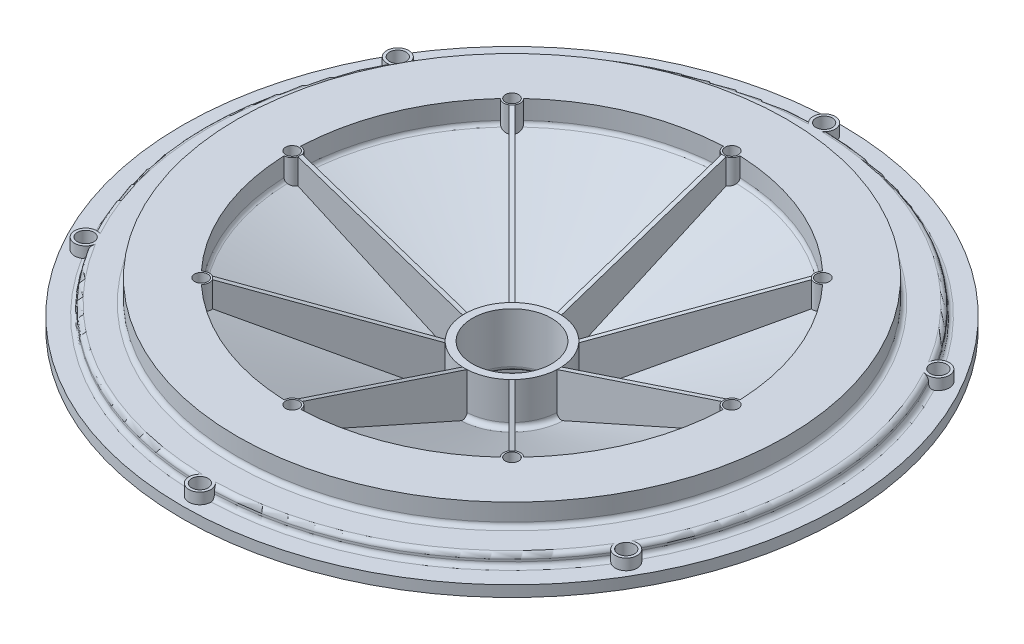
from build123d import *

# Parameters (mm, degrees)
BOSS_EXTRUDE1_REACH = 24.497
SKETCH5_R           = 0.375
BOSS_EXTRUDE2_REACH = 24.187
SKETCH8_R           = 0.5
SKETCH29_R          = 0.3
CUT_EXTRUDE2_DEPTH  = 1
CIRPATTERN4_COUNT   = 8
CIRPATTERN5_COUNT   = 8
SKETCH35_R          = 0.375
CUT_EXTRUDE3_DEPTH  = 1
CIRPATTERN8_COUNT   = 6
CIRPATTERN10_COUNT  = 6
BOSS_EXTRUDE3_REACH = 24.497
CIRPATTERN25_COUNT  = 8
SCALE1_SCALE        = 5


with BuildPart() as part:
    # Sketch4 → Revolve3 (revolve)
    with BuildSketch(Plane.XY, mode=Mode.PRIVATE) as revolve3_sk:
        with BuildLine():
            Line((1.8, 2.5), (1.8, 0.22))
            ThreePointArc((1.8, 0.22), (1.858578644, 0.078578644), (2, 0.02))
            Line((2, 0.02), (4.35, 0.02))
            ThreePointArc((4.35, 0.02), (4.491421356, -0.038578644), (4.55, -0.18))
            Line((4.55, -0.18), (4.55, -1.95))
            ThreePointArc((4.55, -1.95), (4.491421356, -2.091421356), (4.35, -2.15))
            Line((4.35, -2.15), (2.15, -2.15))
            Line((2.15, -2.15), (2.15, -2.3))
            ThreePointArc((2.15, -2.3), (2.208578644, -2.441421356), (2.35, -2.5))
            Line((2.35, -2.5), (4.9, -2.5))
            Line((4.9, -2.5), (4.9, -1.258504677))
            Line((4.9, -1.258504677), (4.9, 1.048861414))
            ThreePointArc((4.9, 1.048861414), (4.932237209, 1.157745049), (5.01855646, 1.231527639))
            Line((5.01855646, 1.231527639), (10.4, 3.63089737))
            Line((10.4, 3.63089737), (13.3, 3.63089737))
            ThreePointArc((13.3, 3.63089737), (13.441421356, 3.572318727), (13.5, 3.43089737))
            Line((13.5, 3.43089737), (13.5, 3))
            Line((13.5, 3), (15, 3))
            Line((15, 3), (15, 3.5))
            Line((15, 3.5), (14.2, 3.5))
            ThreePointArc((14.2, 3.5), (14.058578644, 3.558578644), (14, 3.7))
            Line((14, 3.7), (14, 3.8))
            ThreePointArc((14, 3.8), (13.941421356, 3.941421356), (13.8, 4))
            Line((13.8, 4), (12.7, 4))
            ThreePointArc((12.7, 4), (12.558578644, 4.058578644), (12.5, 4.2))
            Line((12.5, 4.2), (12.5, 4.989962757))
            Line((12.5, 4.989962757), (10, 4.989962757))
            Line((10, 4.989962757), (10, 4.129806657))
            ThreePointArc((10, 4.129806657), (9.967762791, 4.020923022), (9.88144354, 3.947140432))
            Line((9.88144354, 3.947140432), (2.43144354, 0.625484381))
            ThreePointArc((2.43144354, 0.625484381), (2.241116365, 0.640387815), (2.15, 0.808150606))
            Line((2.15, 0.808150606), (2.15, 2.5))
            Line((2.15, 2.5), (1.8, 2.5))
        make_face()
    revolve(revolve3_sk.sketch.rotate(Axis((0, 0, 0), (0, 1, 0)), 90), axis=Axis((0, 0, 0), (0, 1, 0)))

    # Boss-Extrude1: up to this cone (the profile starts inside it)
    boss_extrude1_end = Plane(origin=(0, 4.989963, 0), z_dir=(0, 1, 0)).offset(-5.448560726) * Cone(2.243e-06, 95.693534971, 42.665906312, align=(Align.CENTER, Align.CENTER, Align.MIN), mode=Mode.PRIVATE)
    # Sketch5 → Boss-Extrude1 (add, up to the surface)
    with BuildSketch(Plane(origin=(0, 4.989962757, 0), x_dir=(1, 0, 0), z_dir=(0, 1, 0)), mode=Mode.PRIVATE) as boss_extrude1_sk1:
        with Locations((0, 10)):
            Circle(SKETCH5_R)
    boss_extrude1_tool1 = extrude(boss_extrude1_sk1.sketch, amount=-BOSS_EXTRUDE1_REACH, mode=Mode.PRIVATE) & boss_extrude1_end
    boss_extrude1 = boss_extrude1_tool1.solids().sort_by_distance((0, 4.989963, -10))[0]
    add(boss_extrude1)

    # Boss-Extrude2: up to this face of the body (flat: up to its plane)
    boss_extrude2_end = Plane(part.part.faces().sort_by_distance((0, 3.5, 14.575735931))[0])
    # Sketch8 → Boss-Extrude2 (add, up to the picked face)
    with BuildSketch(Plane(origin=(0, 4, 0), x_dir=(1, 0, 0), z_dir=(0, 1, 0)), mode=Mode.PRIVATE) as boss_extrude2_sk1:
        with Locations((0, 14.2)):
            Circle(SKETCH8_R)
    boss_extrude2_tool1 = split(extrude(boss_extrude2_sk1.sketch, amount=-BOSS_EXTRUDE2_REACH, mode=Mode.PRIVATE), bisect_by=boss_extrude2_end, keep=Keep.BOTH, mode=Mode.PRIVATE)
    boss_extrude2 = boss_extrude2_tool1.solids().sort_by(Axis((0, 4, -14.2), (0, -1, 0)))[0]
    add(boss_extrude2)

    # Sketch29 → Cut-Extrude2 (cut)
    with BuildSketch(Plane(origin=(0, 4.989962757, 0), x_dir=(1, 0, 0), z_dir=(0, 1, 0))):
        with Locations(Location((0, 10, 0), (0, 0, 270))):
            Circle(SKETCH29_R)
    cut_extrude2 = extrude(amount=-CUT_EXTRUDE2_DEPTH, mode=Mode.SUBTRACT)

    # CirPattern4: Boss-Extrude1 ×8 about axis
    cirpattern4_axis = Axis((0, 0, 0), (0, 1, 0))
    for i in range(1, CIRPATTERN4_COUNT):
        add(boss_extrude1.rotate(cirpattern4_axis, i * 360 / CIRPATTERN4_COUNT))

    # CirPattern5: Cut-Extrude2 ×8 about axis
    cirpattern5_axis = Axis((0, 0, 0), (0, 1, 0))
    for i in range(1, CIRPATTERN5_COUNT):
        add(cut_extrude2.rotate(cirpattern5_axis, i * 360 / CIRPATTERN5_COUNT), mode=Mode.SUBTRACT)

    # Sketch35 → Cut-Extrude3 (cut)
    with BuildSketch(Plane(origin=(0, 4, 0), x_dir=(1, 0, 0), z_dir=(0, 1, 0))):
        with Locations(Location((0, 14.2, 0), (0, 0, 270))):
            Circle(SKETCH35_R)
    cut_extrude3 = extrude(amount=-CUT_EXTRUDE3_DEPTH, mode=Mode.SUBTRACT)

    # CirPattern8: Boss-Extrude2 ×6 about axis
    cirpattern8_axis = Axis((0, 0, 0), (0, 1, 0))
    for i in range(1, CIRPATTERN8_COUNT):
        add(boss_extrude2.rotate(cirpattern8_axis, i * 360 / CIRPATTERN8_COUNT))

    # CirPattern10: Cut-Extrude3 ×6 about axis
    cirpattern10_axis = Axis((0, 0, 0), (0, 1, 0))
    for i in range(1, CIRPATTERN10_COUNT):
        add(cut_extrude3.rotate(cirpattern10_axis, i * 360 / CIRPATTERN10_COUNT), mode=Mode.SUBTRACT)

    # Boss-Extrude3: up to this cone (the profile starts inside it)
    boss_extrude3_end = Plane(origin=(0, 4.989963, 0), z_dir=(0, 1, 0)).offset(-5.448560726) * Cone(2.243e-06, 95.693534971, 42.665906312, align=(Align.CENTER, Align.CENTER, Align.MIN), mode=Mode.PRIVATE)
    # Sketch38 → Boss-Extrude3 (add, up to the surface)
    with BuildSketch(Plane(origin=(0, 4.989962757, 0), x_dir=(1, 0, 0), z_dir=(0, 1, 0)), mode=Mode.PRIVATE) as boss_extrude3_sk1:
        with BuildLine():
            Line((0.1, -9.638579193), (0.1, -2.147673159))
            ThreePointArc((0.1, -2.147673159), (0, -2.15), (-0.1, -2.147673159))
            Line((-0.1, -2.147673159), (-0.1, -9.638579193))
            ThreePointArc((-0.1, -9.638579193), (0, -9.625), (0.1, -9.638579193))
        make_face()
    boss_extrude3_tool1 = extrude(boss_extrude3_sk1.sketch, amount=-BOSS_EXTRUDE3_REACH, mode=Mode.PRIVATE) & boss_extrude3_end
    boss_extrude3 = boss_extrude3_tool1.solids().sort_by_distance((0, 4.989963, 5.88936))[0]
    add(boss_extrude3)

    # CirPattern25: Boss-Extrude3 ×8 about axis
    cirpattern25_axis = Axis((0, 0, 0), (0, 1, 0))
    for i in range(1, CIRPATTERN25_COUNT):
        add(boss_extrude3.rotate(cirpattern25_axis, i * 360 / CIRPATTERN25_COUNT))

    # Sketch39 → Cut-Revolve1 (revolve, cut)
    with BuildSketch(Plane.ZY):
        Polygon((2.147673159, 2.5), (9.638579193, 4.989962757), (2.147673159, 4.989962757), align=None)
    revolve(axis=Axis((0, 0, 0), (0, 1, 0)), mode=Mode.SUBTRACT)


with BuildPart() as part_1:
    # Scale1: scaled about (2e-09, 2.907199639, -3e-09)
    add(part.part.scale(SCALE1_SCALE).moved(Location((-8e-09, -11.628798556, 1.2e-08))))


solid = part_1.part
